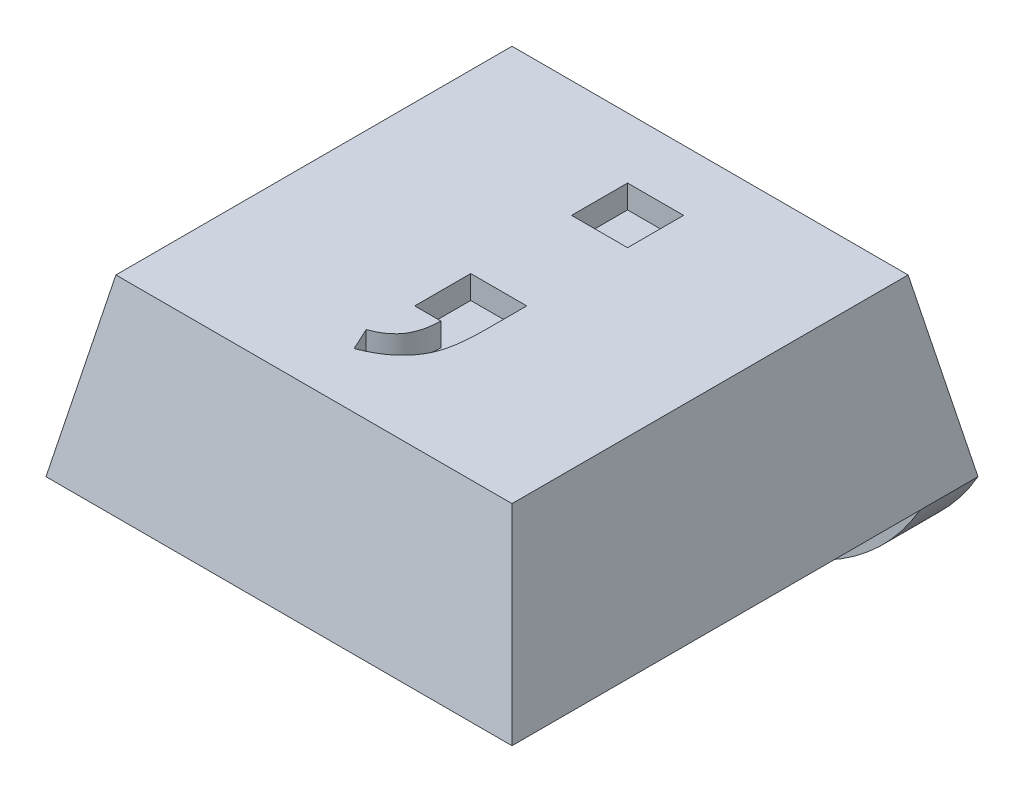
from build123d import *

# Parameters (mm, degrees)
SKETCH1_W               = 8
SKETCH1_H               = 8
BOSS_EXTRUDE1_DEPTH     = 3
CUT_EXTRUDE1_DEPTH      = 12.704699911
CUT_EXTRUDE1_DEPTH_BACK = 12.704699911
CUT_EXTRUDE2_DEPTH      = 11
SKETCH4_R               = 1.8
CUT_EXTRUDE3_DEPTH      = 0.8
SKETCH5_W               = 8
SKETCH5_H               = 1
BOSS_EXTRUDE2_DEPTH     = 2
FILLET1_R               = 4
SKETCH6_W               = 0.961538461
SKETCH6_H               = 0.961538462
CUT_EXTRUDE4_DEPTH      = 0.4


with BuildPart() as part:
    # Sketch1 → Boss-Extrude1 (new body)
    with BuildSketch(Plane(origin=(0, 0, 0), x_dir=(1, 0, 0), z_dir=(0, 1, 0))):
        with Locations((4, 4)):
            Rectangle(SKETCH1_W, SKETCH1_H)
    extrude(amount=BOSS_EXTRUDE1_DEPTH)

    # Sketch2 → Cut-Extrude1 (cut, two sides: drawn at the far end of the back side and taken through both)
    with BuildSketch(Plane.XY.offset(-CUT_EXTRUDE1_DEPTH_BACK)):
        Polygon((0, 0), (0.6, 3), (0, 3), align=None)
        Polygon((8, 0), (7.4, 3), (8, 3), align=None)
    extrude(amount=CUT_EXTRUDE1_DEPTH + CUT_EXTRUDE1_DEPTH_BACK, mode=Mode.SUBTRACT)

    # Sketch3 → Cut-Extrude2 (cut)
    with BuildSketch(Plane(origin=(0, 0, 0), x_dir=(0, 0, -1), z_dir=(1, 0, 0))):
        Polygon((0, 0), (0.6, 3), (0, 3), align=None)
        Polygon((8, 3), (7.4, 3), (8, 0), align=None)
    extrude(amount=CUT_EXTRUDE2_DEPTH, mode=Mode.SUBTRACT)

    # Sketch4 → Cut-Extrude3 (cut)
    with BuildSketch(Plane.XZ):
        with Locations(Location((4, -3.75, 0), (0, 0, 270))):
            Circle(SKETCH4_R)
    extrude(amount=-CUT_EXTRUDE3_DEPTH, mode=Mode.SUBTRACT)

    # Sketch5 → Boss-Extrude2 (add)
    with BuildSketch(Plane.XZ):
        with Locations((4, -7.5)):
            Rectangle(SKETCH5_W, SKETCH5_H)
    extrude(amount=BOSS_EXTRUDE2_DEPTH)

    # Fillet1
    # the kernel refuses this fillet: 4 mm, written as the material it takes off along each edge
    with BuildSketch(Plane(origin=(8, -2, -16.660254038), x_dir=(0, 1, 0), z_dir=(0, 0, 1)), Plane(origin=(0, -2, 1.660254038), x_dir=(0, 1, 0), z_dir=(0, 0, -1))) as fillet1_piece_1:
        with BuildLine():
            CenterArc((4, 3.464101615), FILLET1_R, 180, 60)
            Line((0, 3.464101615), (-0.08, 3.464101615))
            Line((-0.08, 3.464101615), (-0.08, 0))
            Line((-0.08, 0), (0, -0.08))
            ThreePointArc((0, -0.08), (1, -0.08), (1.96, -0.069282032))
            Line((1.96, -0.069282032), (2, 0))
        make_face()
    extrude(amount=18.320508076, mode=Mode.SUBTRACT)

    # Sketch6 → Cut-Extrude4 (cut)
    with BuildSketch(Plane(origin=(0, 3, 0), x_dir=(1, 0, 0), z_dir=(0, 1, 0))):
        with Locations((4.106375193, 5.877622732)):
            Rectangle(SKETCH6_W, SKETCH6_H)
        with BuildLine():
            Line((3.625605963, 3.666084271), (4.587144424, 3.666084271))
            Line((4.587144424, 3.666084271), (4.587144424, 2.966965681))
            add(Edge.make_bspline(
                [(4.587144424, 2.966965681), (4.586700802, 2.899821455), (4.585863185, 2.773044347), (4.571180714, 2.594207821), (4.550779556, 2.437158718), (4.518324342, 2.299878361), (4.47486997, 2.175902827), (4.413432502, 2.062461013), (4.337876173, 1.953901165), (4.245458326, 1.85350819), (4.139144335, 1.760654771), (4.017702284, 1.679908688), (3.88401418, 1.607967915), (3.787969656, 1.570094118), (3.738787052, 1.550699655)],
                knots=[0, 0, 0, 0, 1.347156832, 2.543608823, 3.599300285, 4.522475688, 5.370350604, 6.227678973, 7.103274953, 8.018757603, 8.959280198, 9.929437417, 10.939703653, 12, 12, 12, 12], degree=3))
            Line((3.738787052, 1.550699655), (3.561503399, 1.93531504))
            add(Edge.make_bspline(
                [(3.561503399, 1.93531504), (3.604439047, 1.952873279), (3.686527672, 1.986442858), (3.795938691, 2.052543314), (3.885105421, 2.129792439), (3.955780801, 2.218165676), (4.006656804, 2.32038588), (4.045456087, 2.435104657), (4.0674697, 2.56519407), (4.07197182, 2.656725854), (4.074323911, 2.704545809)],
                knots=[0, 0, 0, 0, 1.115416734, 2.132564161, 3.06091458, 3.941973359, 4.836922823, 5.794989041, 6.848011894, 8, 8, 8, 8], degree=3))
            Line((4.074323911, 2.704545809), (3.625605963, 2.704545809))
            Line((3.625605963, 2.704545809), (3.625605963, 3.666084271))
        make_face()
    extrude(amount=-CUT_EXTRUDE4_DEPTH, mode=Mode.SUBTRACT)


solid = part.part
